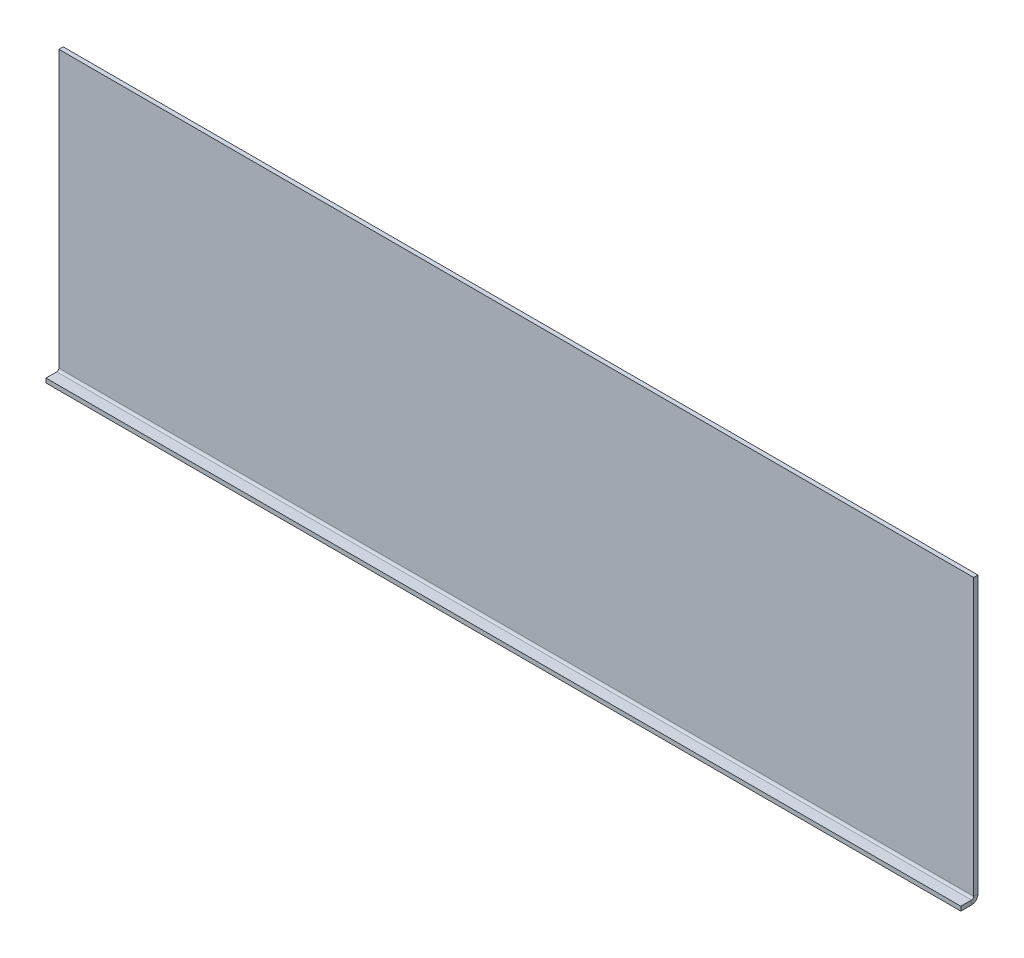
from build123d import *

# Parameters (mm, degrees)
SKETCH1_W          = 676.402
SKETCH1_H          = 204.15504
BASE_FLANGE1_DEPTH = 3.175
EDGE_FLANGE1_DEPTH = 676.402
SKETCH9_R          = 9.525
CUT_EXTRUDE1_DEPTH = 3.175


# Sheet-metal steps are written as plain solids
with BuildPart() as part:
    # Sketch1 → Base-Flange1 (new body)
    with BuildSketch(Plane.XY):
        with Locations((338.201, 102.07752)):
            Rectangle(SKETCH1_W, SKETCH1_H)
    extrude(amount=-BASE_FLANGE1_DEPTH)

    # Edge-Flange1 section (across the edge) → Edge-Flange1 (add)
    with BuildSketch(Plane(origin=(0, -1.5875, 0), x_dir=(0, 1, 0), z_dir=(1, 0, 0))):
        with BuildLine():
            Line((-3.175, 1.5875), (-3.175, 9.525))
            Line((-3.175, 9.525), (0, 9.525))
            Line((0, 9.525), (0, 1.5875))
            ThreePointArc((0, 1.5875), (0.464967985, 0.464967985), (1.5875, 0))
            Line((1.5875, 0), (1.5875, -3.175))
            ThreePointArc((1.5875, -3.175), (-1.780096045, -1.780096045), (-3.175, 1.5875))
        make_face()
    extrude(amount=EDGE_FLANGE1_DEPTH)

    # Sketch9 → Cut-Extrude1 (cut)
    with BuildSketch(Plane(origin=(0, 0, 1.251039998), x_dir=(-1, 0, 0), z_dir=(0, 0, -1))):
        with Locations((-267.508853456, 43.732259818)):
            Circle(SKETCH9_R)
        with Locations((-180.176306543, 43.732259818)):
            Circle(SKETCH9_R)
        with Locations((-38.908853456, 43.732259818)):
            Circle(SKETCH9_R)
        with Locations((-637.376306543, 43.732259818)):
            Circle(SKETCH9_R)
        with Locations((-496.108853456, 43.732259818)):
            Circle(SKETCH9_R)
        with Locations((-408.776306543, 43.732259818)):
            Circle(SKETCH9_R)
        with Locations((-38.908853456, 163.597780182)):
            Circle(SKETCH9_R)
        with Locations((-180.176306543, 163.597780182)):
            Circle(SKETCH9_R)
        with Locations((-408.776306543, 163.597780182)):
            Circle(SKETCH9_R)
        with Locations((-267.508853456, 163.597780182)):
            Circle(SKETCH9_R)
        with Locations((-637.376306543, 163.597780182)):
            Circle(SKETCH9_R)
        with Locations((-496.108853456, 163.597780182)):
            Circle(SKETCH9_R)
    extrude(amount=-CUT_EXTRUDE1_DEPTH, mode=Mode.SUBTRACT)


solid = part.part
